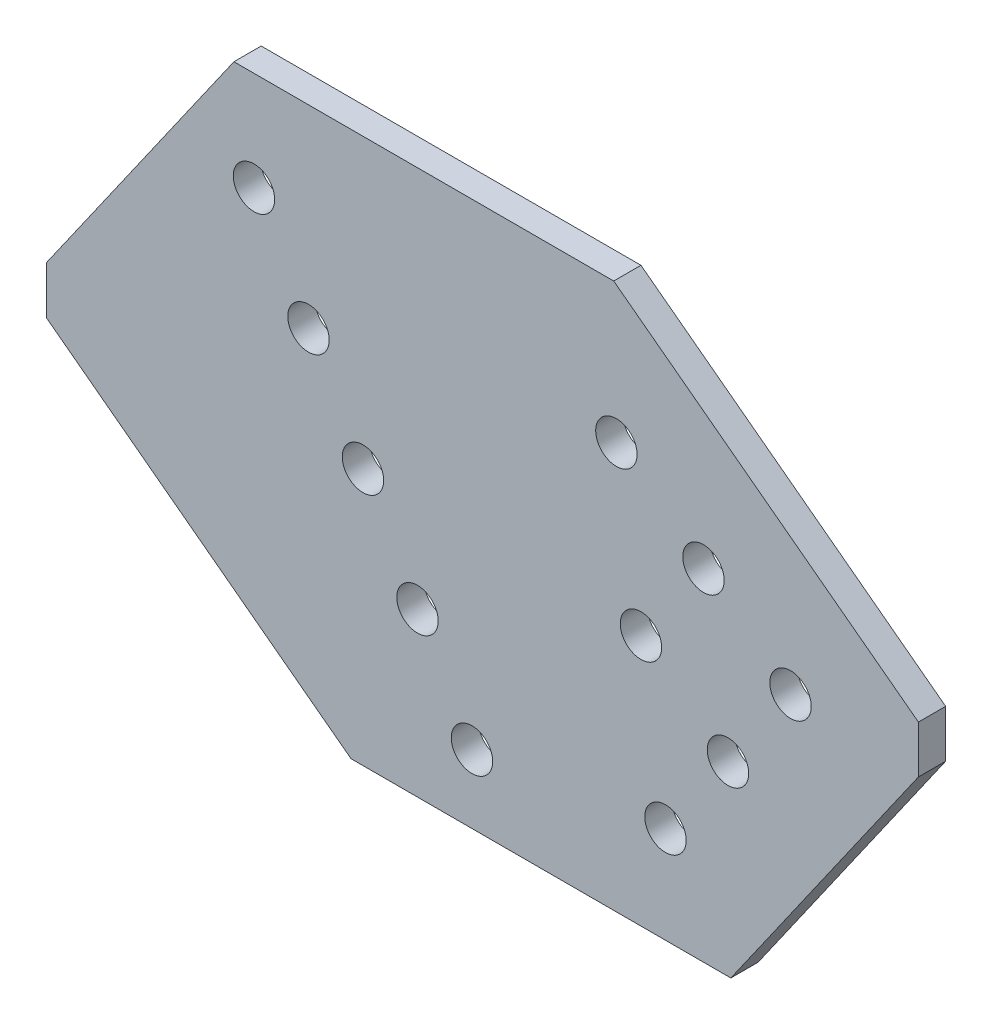
from build123d import *

# Parameters (mm, degrees)
SKETCH1_W           = 101.6
SKETCH1_H           = 63.5
BOSS_EXTRUDE1_DEPTH = 3.175
CUT_EXTRUDE1_DEPTH  = 120.85362166
CUT_EXTRUDE2_DEPTH  = 120.85362166
SKETCH4_R           = 2.413
CUT_EXTRUDE3_DEPTH  = 120.85362166
SKETCH5_R           = 2.413
CUT_EXTRUDE4_DEPTH  = 120.85362166


with BuildPart() as part:
    # Sketch1 → Boss-Extrude1 (new body)
    with BuildSketch(Plane.XY):
        with Locations((50.8, 31.75)):
            Rectangle(SKETCH1_W, SKETCH1_H)
    extrude(amount=BOSS_EXTRUDE1_DEPTH)

    # Sketch2 → Cut-Extrude1 (cut, through all)
    with BuildSketch(Plane.XY.offset(3.175)):
        Polygon((101.6, 31.209692887), (79.746737775, 0), (101.6, 0), align=None)
        Polygon((101.6, 36.749322221), (66.100651578, 63.5), (101.6, 63.5), align=None)
    extrude(amount=-CUT_EXTRUDE1_DEPTH, mode=Mode.SUBTRACT)

    # Sketch3 → Cut-Extrude2 (cut, through all)
    with BuildSketch(Plane.XY.offset(3.175)):
        Polygon((21.853262225, 63.5), (0, 32.290307113), (0, 63.5), align=None)
        Polygon((0, 0), (0, 26.750677779), (35.499348422, 0), align=None)
    extrude(amount=-CUT_EXTRUDE2_DEPTH, mode=Mode.SUBTRACT)

    # Sketch4 → Cut-Extrude3 (cut, through all)
    with BuildSketch(Plane.XY.offset(3.175)):
        with Locations((49.59148185, 7.959897775)):
            Circle(SKETCH4_R)
        with Locations((43.24148185, 18.958420404)):
            Circle(SKETCH4_R)
        with Locations((36.89148185, 29.956943032)):
            Circle(SKETCH4_R)
        with Locations((30.54148185, 40.95546566)):
            Circle(SKETCH4_R)
        with Locations((24.19148185, 51.953988288)):
            Circle(SKETCH4_R)
    extrude(amount=-CUT_EXTRUDE3_DEPTH, mode=Mode.SUBTRACT)

    # Sketch5 → Cut-Extrude4 (cut, through all)
    with BuildSketch(Plane.XY.offset(3.175)):
        with Locations((86.701417617, 32.074086458)):
            Circle(SKETCH5_R)
        with Locations((76.558746639, 39.717137252)):
            Circle(SKETCH5_R)
        with Locations((66.416075662, 47.360188046)):
            Circle(SKETCH5_R)
        with Locations((69.274325898, 29.31390629)):
            Circle(SKETCH5_R)
        with Locations((79.416996875, 21.670855495)):
            Circle(SKETCH5_R)
        with Locations((72.132576133, 11.267624533)):
            Circle(SKETCH5_R)
    extrude(amount=-CUT_EXTRUDE4_DEPTH, mode=Mode.SUBTRACT)


solid = part.part
